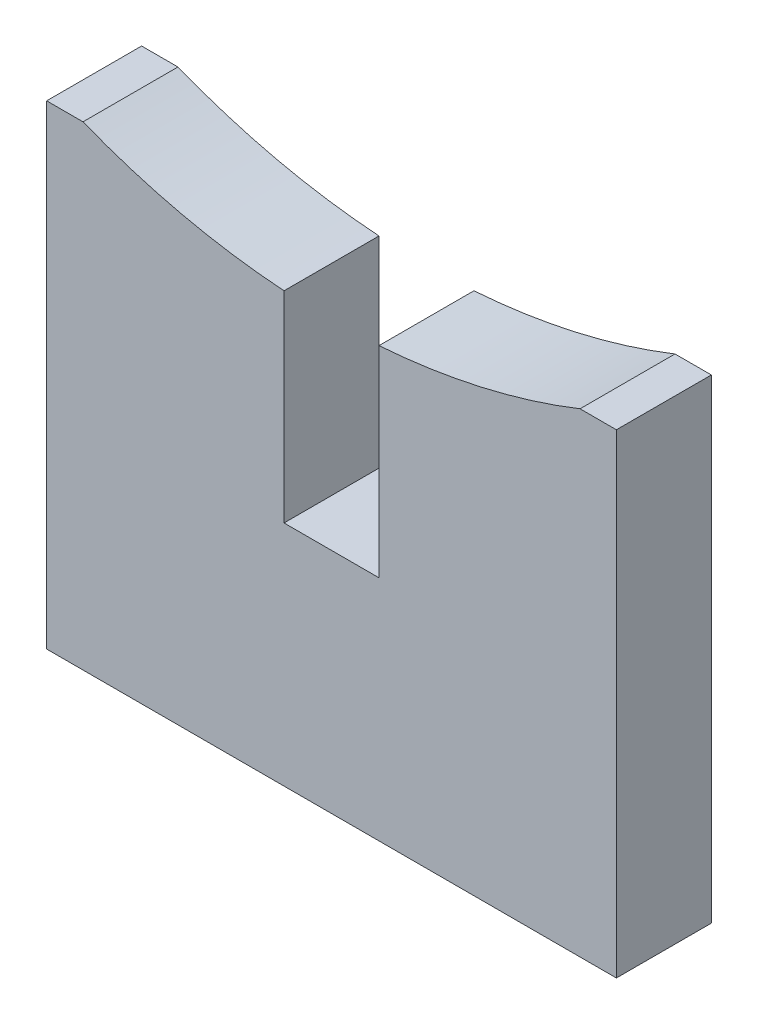
from build123d import *

# Parameters (mm, degrees)
SKETCH1_W               = 30
SKETCH1_H               = 25
BOSS_EXTRUDE1_DEPTH     = 5
BOSS_EXTRUDE6_START     = -5
BOSS_EXTRUDE6_OUTLINE_W = 5
BOSS_EXTRUDE6_OUTLINE_H = 13
BOSS_EXTRUDE6_DEPTH     = 5
SKETCH5_R               = 35.5
CUT_EXTRUDE1_DEPTH      = 31


# Read off the part's stored shape, not the designer's step: Boss-Extrude6
with BuildPart() as part:
    # Sketch1 → Boss-Extrude1 (new body)
    with BuildSketch(Plane.XY):
        with Locations((15, 12.5)):
            Rectangle(SKETCH1_W, SKETCH1_H)
    extrude(amount=BOSS_EXTRUDE1_DEPTH)

    # Boss-Extrude6 outline → Boss-Extrude6 (cut)
    with BuildSketch(Plane.XY.offset(5).offset(BOSS_EXTRUDE6_START)):
        with Locations((15, 18.5)):
            Rectangle(BOSS_EXTRUDE6_OUTLINE_W, BOSS_EXTRUDE6_OUTLINE_H)
    extrude(amount=BOSS_EXTRUDE6_DEPTH, mode=Mode.SUBTRACT)

    # Sketch5 → Cut-Extrude1 (cut)
    with BuildSketch(Plane.XY.offset(5)):
        with Locations((15, 58)):
            Circle(SKETCH5_R)
    extrude(amount=-CUT_EXTRUDE1_DEPTH, mode=Mode.SUBTRACT)


solid = part.part
